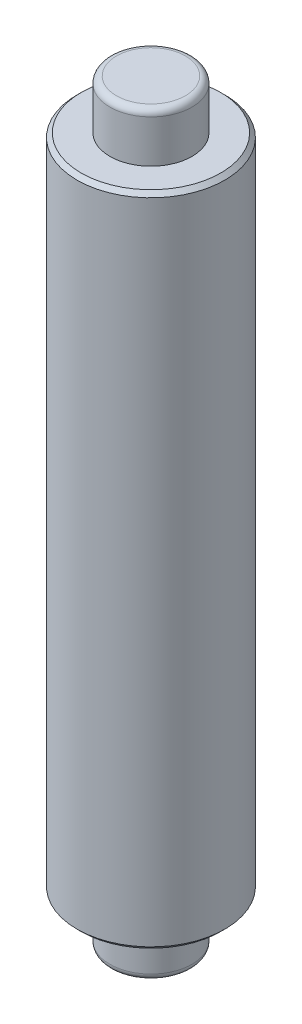
from build123d import *

# Parameters (mm, degrees)
SKETCH1_R           = 2.5
BOSS_EXTRUDE1_DEPTH = 46
FILLET5_R           = 0.4
SKETCH2_R           = 4.5
BOSS_EXTRUDE2_DEPTH = 20
CHAMFER1_SIZE       = 0.25


with BuildPart() as part:
    # Sketch1 → Boss-Extrude1 (new body)
    with BuildSketch(Plane(origin=(0, 0, 0), x_dir=(1, 0, 0), z_dir=(0, 1, 0))):
        Circle(SKETCH1_R)
    extrude(amount=BOSS_EXTRUDE1_DEPTH)

    # Fillet5
    fillet5_edges = [part.edges().sort_by_distance(p)[0] for p in [
        (-2.5, 0, 0),
        (-2.5, 46, 0),
    ]]
    fillet(fillet5_edges, radius=FILLET5_R)

    # Sketch2 → Boss-Extrude2 (add, symmetric)
    with BuildSketch(Plane(origin=(0, 23, 0), x_dir=(1, 0, 0), z_dir=(0, 1, 0))):
        Circle(SKETCH2_R)
    extrude(amount=BOSS_EXTRUDE2_DEPTH, both=True)

    # Chamfer1
    chamfer1_edges = [part.edges().sort_by_distance(p)[0] for p in [
        (-4.5, 3, 0),
        (-4.5, 43, 0),
    ]]
    chamfer(chamfer1_edges, length=CHAMFER1_SIZE)


solid = part.part
